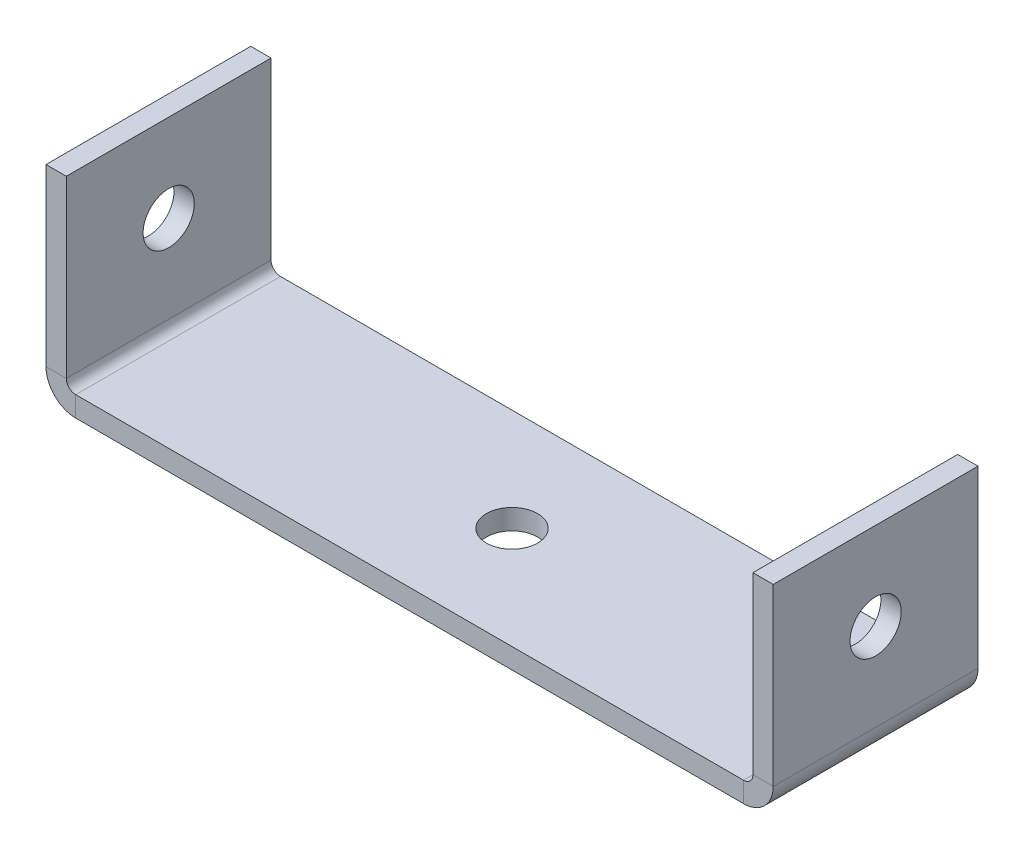
from build123d import *

# Parameters (mm, degrees)
SKETCH1_W                      = 56.83
SKETCH1_H                      = 16
SKETCH1_R                      = 2
BASE_FLANGE1_DEPTH             = 1.5875
EDGE_FLANGE1_STRIP_W           = 7.8232
EDGE_FLANGE1_STRIP_H           = 1.5875
EDGE_FLANGE1_STRIP_CUT_DEPTH   = 16
EDGE_FLANGE1_STRIP_2_W         = 7.8232
EDGE_FLANGE1_STRIP_2_H         = 1.5875
EDGE_FLANGE1_STRIP_CUT_2_DEPTH = 16
EDGE_FLANGE1_DEPTH             = 16
EDGE_FLANGE1_BEND_DEPTH        = 16
SKETCH12_R                     = 2
CUT_EXTRUDE1_DEPTH             = 61.773094839


# Sheet-metal steps are written as plain solids
with BuildPart() as part:
    # Sketch1 → Base-Flange1 (new body)
    with BuildSketch(Plane(origin=(0, 0, 0), x_dir=(1, 0, 0), z_dir=(0, 1, 0))):
        with Locations((28.415, 8)):
            Rectangle(SKETCH1_W, SKETCH1_H)
        with Locations(Location((28.415, 8, 0), (0, 0, 270))):
            Circle(SKETCH1_R, mode=Mode.SUBTRACT)
    extrude(amount=-BASE_FLANGE1_DEPTH)

    # Edge-Flange1 strip (across the edge) → Edge-Flange1 strip cut (cut)
    with BuildSketch(Plane(origin=(56.83, 0, 0), x_dir=(-1, 0, 0), z_dir=(0, 0, -1))):
        with Locations((-1.5875, -0.79375)):
            Rectangle(EDGE_FLANGE1_STRIP_W, EDGE_FLANGE1_STRIP_H)
    extrude(amount=EDGE_FLANGE1_STRIP_CUT_DEPTH, mode=Mode.SUBTRACT)

    # Edge-Flange1 strip 2 (across the edge) → Edge-Flange1 strip cut 2 (cut)
    with BuildSketch(Plane.XY.offset(-16)):
        with Locations((-1.5875, -0.79375)):
            Rectangle(EDGE_FLANGE1_STRIP_2_W, EDGE_FLANGE1_STRIP_2_H)
    extrude(amount=EDGE_FLANGE1_STRIP_CUT_2_DEPTH, mode=Mode.SUBTRACT)

    # Edge-Flange1 section (across the edge) → Edge-Flange1 (add)
    with BuildSketch(Plane(origin=(56.83, 0, 0), x_dir=(-1, 0, 0), z_dir=(0, 0, -1))):
        with BuildLine():
            Line((0, 0.7366), (0, 14.4125))
            Line((0, 14.4125), (1.5875, 14.4125))
            Line((1.5875, 14.4125), (1.5875, 0.7366))
            ThreePointArc((1.5875, 0.7366), (1.803245145, 0.215745145), (2.3241, 0))
            Line((2.3241, 0), (2.3241, -1.5875))
            ThreePointArc((2.3241, -1.5875), (0.68071313, -0.90678687), (0, 0.7366))
        make_face()
    extrude(amount=EDGE_FLANGE1_DEPTH)

    # Edge-Flange1 section 2 (across the edge) → Edge-Flange1 bend (add)
    with BuildSketch(Plane.XY.offset(-16)):
        with BuildLine():
            Line((0, 0.7366), (0, 14.4125))
            Line((0, 14.4125), (1.5875, 14.4125))
            Line((1.5875, 14.4125), (1.5875, 0.7366))
            ThreePointArc((1.5875, 0.7366), (1.803245145, 0.215745145), (2.3241, 0))
            Line((2.3241, 0), (2.3241, -1.5875))
            ThreePointArc((2.3241, -1.5875), (0.68071313, -0.90678687), (0, 0.7366))
        make_face()
    extrude(amount=EDGE_FLANGE1_BEND_DEPTH)

    # Sketch12 → Cut-Extrude1 (cut, through all)
    with BuildSketch(Plane(origin=(56.83, 0, 0), x_dir=(0, 0, -1), z_dir=(1, 0, 0))):
        with Locations(Location((8, 7.57455, 0), (0, 0, 90))):
            Circle(SKETCH12_R)
    extrude(amount=-CUT_EXTRUDE1_DEPTH, mode=Mode.SUBTRACT)


solid = part.part
